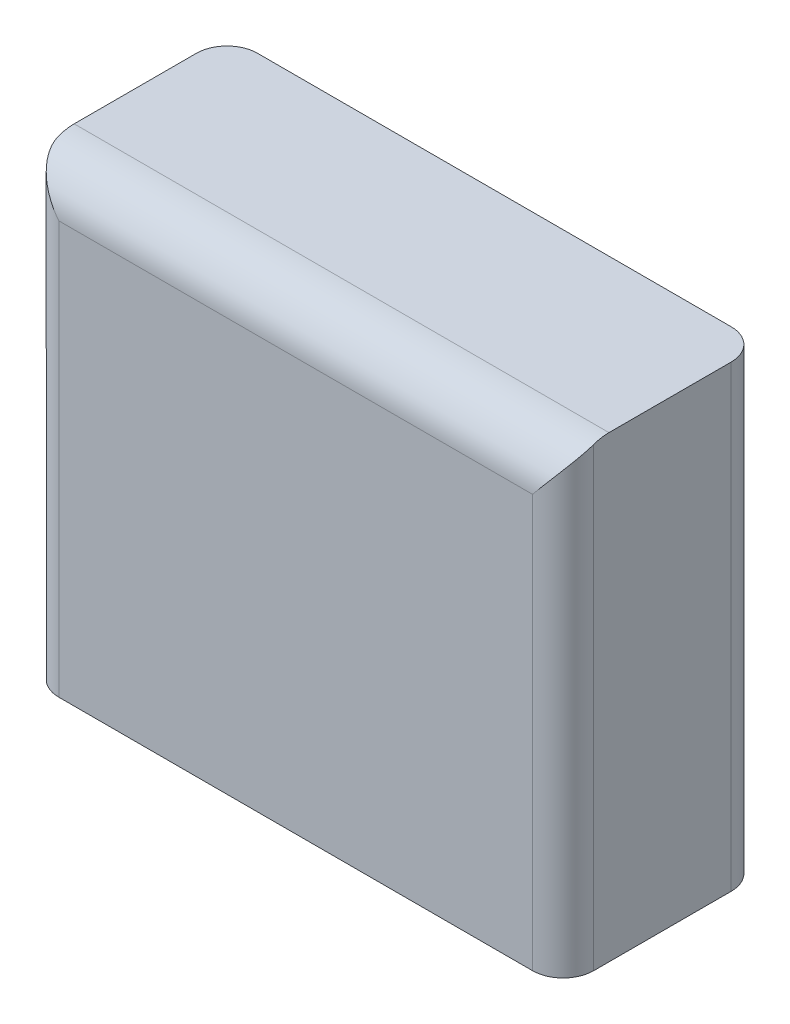
from build123d import *

# Parameters (mm, degrees)
SKETCH1_W                   = 35
SKETCH1_H                   = 13
BOSS_EXTRUDE1_DEPTH         = 30
FILLET1_R                   = 2
FILLET2_R                   = 3
M6_TAPPED_HOLE1_D           = 5
M6_TAPPED_HOLE1_DEPTH       = 17
M6_TAPPED_HOLE1_CSINK_D     = 6.05
M6_TAPPED_HOLE1_CSINK_ANGLE = 90
M6_TAPPED_HOLE1_TIP         = 1.502151548


with BuildPart() as part:
    # Sketch1 → Boss-Extrude1 (new body)
    with BuildSketch(Plane(origin=(0, 0, 0), x_dir=(1, 0, 0), z_dir=(0, 1, 0))):
        Rectangle(SKETCH1_W, SKETCH1_H)
    extrude(amount=-BOSS_EXTRUDE1_DEPTH)

    # Fillet1
    fillet1_edges = [part.edges().sort_by_distance(p)[0] for p in [
        (17.5, -15, 6.5),
        (-17.5, -15, 6.5),
        (-17.5, -15, -6.5),
        (17.5, -15, -6.5),
    ]]
    fillet(fillet1_edges, radius=FILLET1_R)

    # Fillet2
    # the kernel refuses this fillet: 3 mm, written as the material it takes off along each edge
    with BuildSketch(Plane(origin=(-23, 0, 6.5), x_dir=(0, -1, 0), z_dir=(1, 0, 0))) as fillet2_piece_1:
        with BuildLine():
            CenterArc((FILLET2_R, FILLET2_R), FILLET2_R, 180, 90)
            Line((0, FILLET2_R), (0, 0))
            Line((0, 0), (FILLET2_R, 0))
        make_face()
    extrude(amount=46, mode=Mode.SUBTRACT)

    # M6 Tapped Hole1
    with Locations(Plane(origin=(0, -30, 0), x_dir=(-1, 0, 0), z_dir=(0, -1, 0))):
        with Locations((-10, 0), (10, 0)):
            CounterSinkHole(M6_TAPPED_HOLE1_D / 2, M6_TAPPED_HOLE1_CSINK_D / 2, depth=M6_TAPPED_HOLE1_DEPTH, counter_sink_angle=M6_TAPPED_HOLE1_CSINK_ANGLE)
            with Locations((0, 0, -(M6_TAPPED_HOLE1_DEPTH + M6_TAPPED_HOLE1_TIP / 2))):  # 118° drill point
                Cone(0, M6_TAPPED_HOLE1_D / 2, M6_TAPPED_HOLE1_TIP, mode=Mode.SUBTRACT)


solid = part.part
